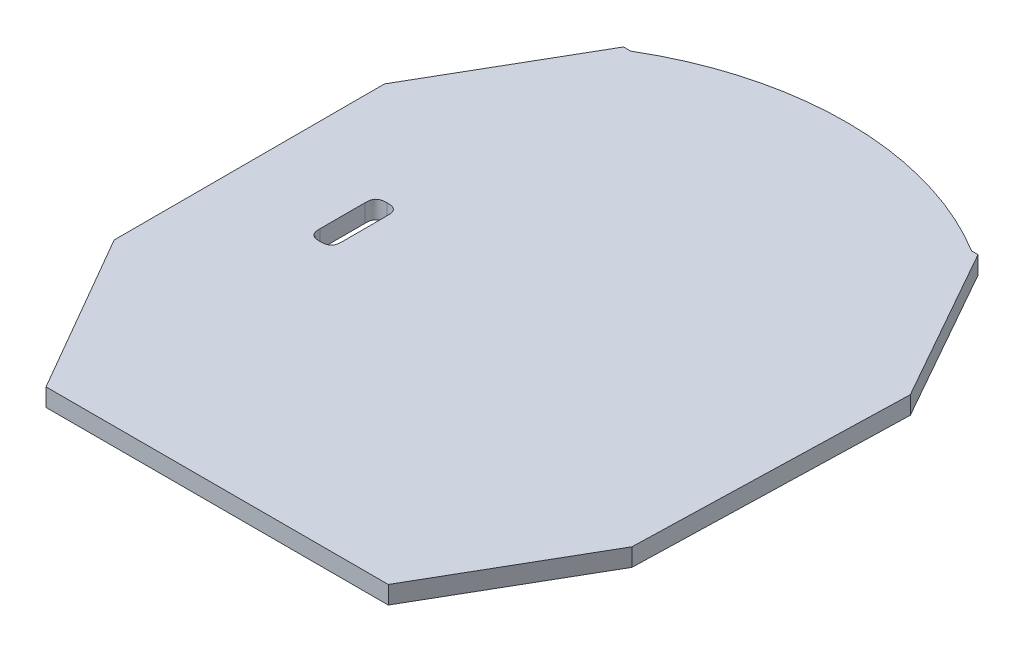
from build123d import *

# Parameters (mm, degrees)
SKETCH2_W           = 2
SKETCH2_H           = 6
BOSS_EXTRUDE1_DEPTH = 1.6
FILLET1_SIZE        = 1


with BuildPart() as part:
    # Sketch2 → Boss-Extrude1 (new body)
    with BuildSketch(Plane(origin=(0, 0, 0), x_dir=(1, 0, 0), z_dir=(0, 1, 0))):
        with BuildLine():
            Line((-123.876706844, -10.393367026), (-123.876706844, -34.615283413))
            Line((-123.876706844, -34.615283413), (-115.532924627, -49.06713814))
            Line((-115.532924627, -49.06713814), (-84.860830246, -49.06713814))
            Line((-84.860830246, -49.06713814), (-76.867006735, -35.221429673))
            Line((-76.867006735, -35.221429673), (-76.19895922, -10.944023897))
            Line((-76.19895922, -10.944023897), (-84.03338266, 2.952288601))
            Line((-84.03338266, 2.952288601), (-84.615952241, 2.956571663))
            ThreePointArc((-84.615952241, 2.956571663), (-99.977425615, 7.344868085), (-115.401760623, 3.182909496))
            Line((-115.401760623, 3.182909496), (-116.035748857, 3.187570589))
            Line((-116.035748857, 3.187570589), (-123.876706844, -10.393367026))
        make_face()
        with Locations((-114.526706844, -22.504325219)):
            Rectangle(SKETCH2_W, SKETCH2_H, mode=Mode.SUBTRACT)
    extrude(amount=BOSS_EXTRUDE1_DEPTH)

    # Fillet1
    # a fillet whose section is not a circle: 1 mm, written as the material it adds along each edge
    with BuildSketch(Plane(origin=(-113.526706844, 0, 25.504325219), x_dir=(0, 0, -1), z_dir=(0, 1, 0)), Plane(origin=(-115.526706844, 0, 25.504325219), x_dir=(1, 0, 0), z_dir=(0, 1, 0)), Plane(origin=(-115.526706844, 0, 19.504325219), x_dir=(0, 0, 1), z_dir=(0, 1, 0))) as fillet1_piece_1:
        with BuildLine():
            add(Edge.make_bspline([(FILLET1_SIZE, 0), (FILLET1_SIZE * 0.831801948466, 0), (FILLET1_SIZE * 0.663603896932, 0), (FILLET1_SIZE * 0.292893218813, FILLET1_SIZE * 0.0716919198361), (FILLET1_SIZE * 0.0716919198361, FILLET1_SIZE * 0.292893218813), (0, FILLET1_SIZE * 0.663603896932), (0, FILLET1_SIZE * 0.831801948466), (0, FILLET1_SIZE)], knots=[0, 0, 0, 0, 0, 0, 0.5, 0.5, 1, 1, 1, 1, 1, 1], degree=5))
            Line((0, FILLET1_SIZE), (-FILLET1_SIZE * 0.02, FILLET1_SIZE))
            Line((-FILLET1_SIZE * 0.02, FILLET1_SIZE), (-FILLET1_SIZE * 0.02, -FILLET1_SIZE * 0.02))
            Line((-FILLET1_SIZE * 0.02, -FILLET1_SIZE * 0.02), (FILLET1_SIZE, -FILLET1_SIZE * 0.02))
            Line((FILLET1_SIZE, -FILLET1_SIZE * 0.02), (FILLET1_SIZE, 0))
        make_face()
    extrude(amount=1.6)
    with BuildSketch(Plane(origin=(-113.526706844, 0, 19.504325219), x_dir=(0, 0, 1), z_dir=(0, 1, 0))) as fillet1_piece_2:
        with BuildLine():
            add(Edge.make_bspline([(FILLET1_SIZE, 0), (FILLET1_SIZE * 0.831801948466, 0), (FILLET1_SIZE * 0.663603896932, 0), (FILLET1_SIZE * 0.292893218813, -FILLET1_SIZE * 0.0716919198361), (FILLET1_SIZE * 0.0716919198361, -FILLET1_SIZE * 0.292893218813), (0, -FILLET1_SIZE * 0.663603896932), (0, -FILLET1_SIZE * 0.831801948466), (0, -FILLET1_SIZE)], knots=[0, 0, 0, 0, 0, 0, 0.5, 0.5, 1, 1, 1, 1, 1, 1], degree=5))
            Line((0, -FILLET1_SIZE), (-FILLET1_SIZE * 0.02, -FILLET1_SIZE))
            Line((-FILLET1_SIZE * 0.02, -FILLET1_SIZE), (-FILLET1_SIZE * 0.02, FILLET1_SIZE * 0.02))
            Line((-FILLET1_SIZE * 0.02, FILLET1_SIZE * 0.02), (FILLET1_SIZE, FILLET1_SIZE * 0.02))
            Line((FILLET1_SIZE, FILLET1_SIZE * 0.02), (FILLET1_SIZE, 0))
        make_face()
    extrude(amount=1.6)


solid = part.part
